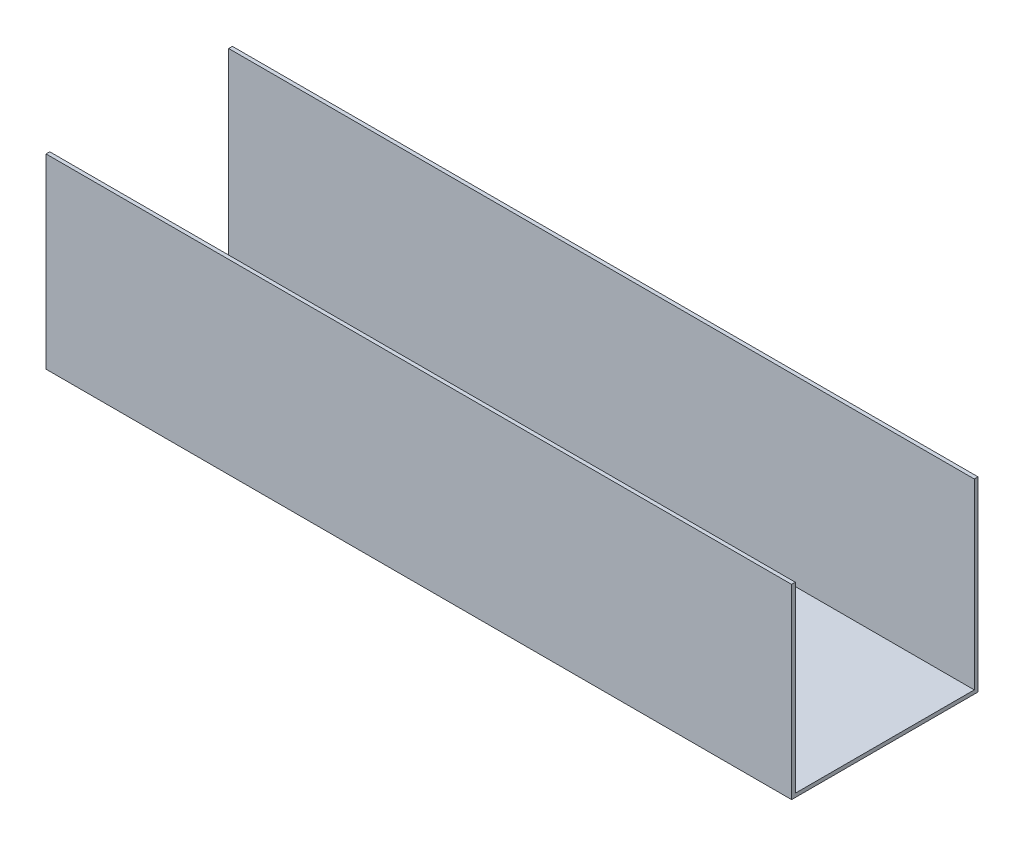
from build123d import *

# Parameters (mm, degrees)
BOSS_EXTRUDE1_DEPTH = 400


with BuildPart() as part:
    # Sketch1 → Boss-Extrude1 (new body)
    with BuildSketch(Plane(origin=(0, 0, 0), x_dir=(0, 0, -1), z_dir=(1, 0, 0))):
        Polygon((0, 100.023872002), (2, 100.023872002), (2, 2), (98, 2), (98, 100), (100, 100), (100, 0), (0, 0), align=None)
    extrude(amount=BOSS_EXTRUDE1_DEPTH)


solid = part.part
